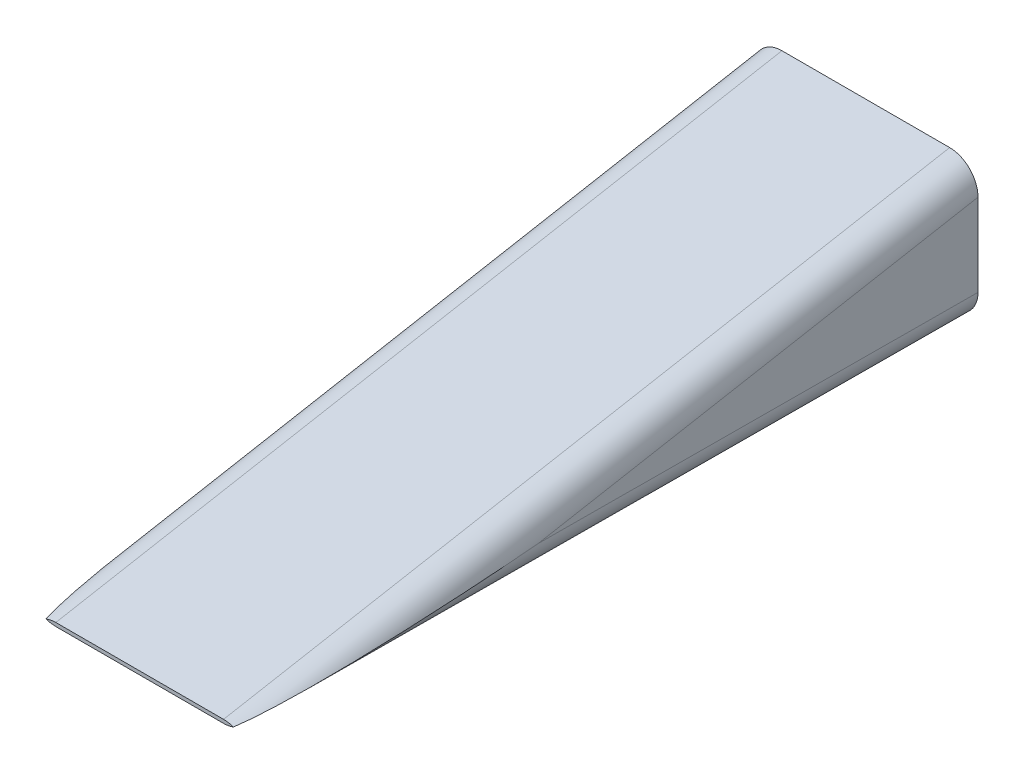
from build123d import *

# Parameters (mm, degrees)
SHELL1_T  = -3.0734
FILLET1_R = 5.08


with BuildPart() as part:
    # Sketch1 → Loft1 section 0
    with BuildSketch(Plane.XY):
        with BuildLine():
            Line((20.1168, 12.5095), (-20.1168, 12.5095))
            Line((-20.1168, 12.5095), (-20.1168, -12.5095))
            Line((-20.1168, -12.5095), (20.1168, -12.5095))
            Line((20.1168, -12.5095), (20.1168, 12.5095))
        make_face()
    # 3DSketch1 → Loft1 section 1
    with BuildSketch(Plane(origin=(-20.1168, -11.811, 130.175), x_dir=(0.9998754744294865, 0.015780862917132092, 0), z_dir=(0, 0, 1))):
        with BuildLine():
            Line((0, 0), (40.228589888, -0.634920926))
            Line((40.228589888, -0.634920926), (40.238610736, 0))
            Line((40.238610736, 0), (0.010020848, 0.634920926))
            Line((0.010020848, 0.634920926), (0, 0))
        make_face()
    loft()

    # Shell1
    shell1_openings = [part.faces().sort_by_distance(p)[0] for p in [
        (0, 0, 0),
    ]]
    offset(amount=SHELL1_T, openings=shell1_openings, kind=Kind.INTERSECTION)

    # Fillet1
    # the kernel refuses this fillet: 5.08 mm, written as the material it takes off along each edge
    with BuildSketch(Plane(origin=(20.1168, 14.78295414, -12.494855192), x_dir=(-1, 0, 0), z_dir=(0, -0.1790121369959656, 0.9838468655274243))) as fillet1_piece_1:
        with BuildLine():
            CenterArc((FILLET1_R, FILLET1_R), FILLET1_R, 180, 90)
            Line((0, FILLET1_R), (0, 0))
            Line((0, 0), (FILLET1_R, 0))
        make_face()
    extrude(amount=157.712257691, mode=Mode.SUBTRACT)
    with BuildSketch(Plane(origin=(-20.1168, 14.78295414, -12.494855192), x_dir=(1, 0, 0), z_dir=(0, -0.17901213699596547, 0.9838468655274243))) as fillet1_piece_2:
        with BuildLine():
            CenterArc((FILLET1_R, -FILLET1_R), FILLET1_R, 90, 90)
            Line((0, -FILLET1_R), (0, 0))
            Line((0, 0), (FILLET1_R, 0))
        make_face()
    extrude(amount=157.712257691, mode=Mode.SUBTRACT)
    with BuildSketch(Plane(origin=(-20.1168, -12.57764536, -12.699817172), x_dir=(0, 0.9999856041181256, -0.005365776412341061), z_dir=(0, 0.0053657764123410615, 0.9999856041181258)), Plane(origin=(20.1168, -12.57764536, -12.699817172), x_dir=(-1, 0, 0), z_dir=(0, 0.0053657764123410485, 0.9999856041181258))) as fillet1_piece_3:
        with BuildLine():
            CenterArc((FILLET1_R, -FILLET1_R), FILLET1_R, 90, 90)
            Line((0, -FILLET1_R), (0, 0))
            Line((0, 0), (FILLET1_R, 0))
        make_face()
    extrude(amount=155.576874011, mode=Mode.SUBTRACT)


solid = part.part
